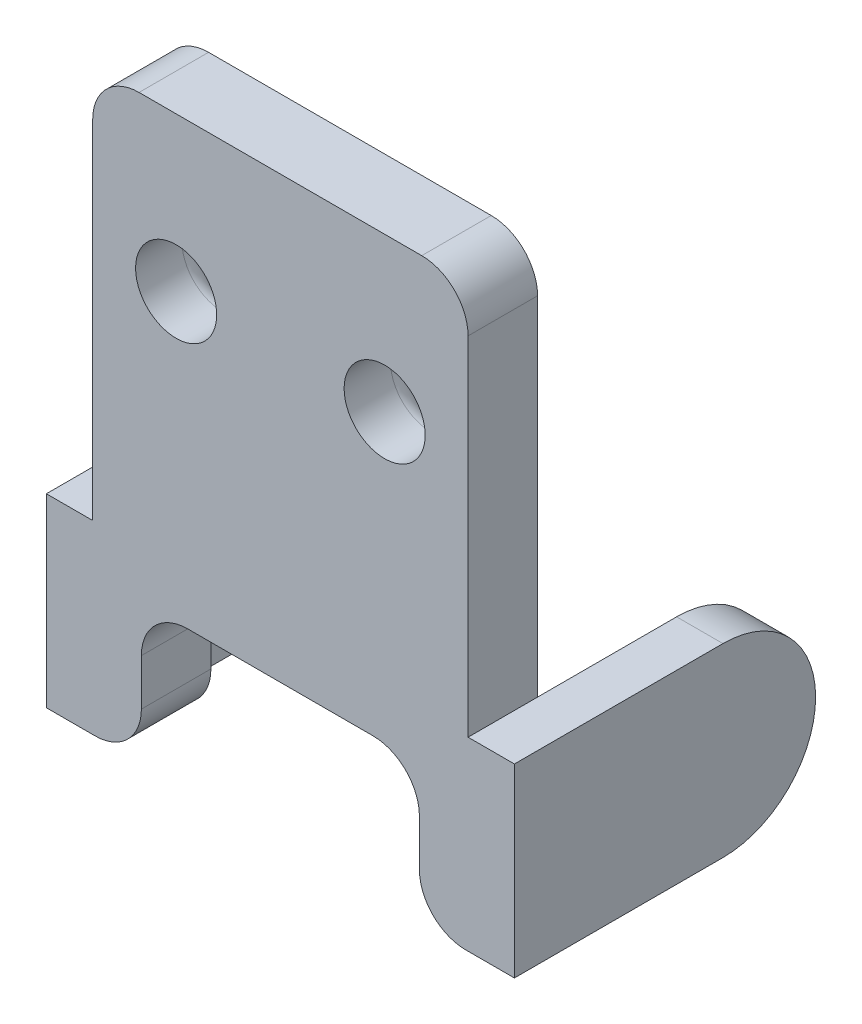
from build123d import *

# Parameters (mm, degrees)
ESQUISSE1_W             = 16.2
ESQUISSE1_H             = 25
BOSS_EXTRU_1_DEPTH      = 3
ESQUISSE2_W             = 13
ESQUISSE2_H             = 8
BOSS_EXTRU_2_DEPTH      = 2
ESQUISSE3_R             = 1.8
BOSS_EXTRU_3_DEPTH      = 1.5
ESQUISSE5_W             = 13
ESQUISSE5_H             = 8
BOSS_EXTRU_4_DEPTH      = 2
ESQUISSE6_R             = 1.8
BOSS_EXTRU_5_DEPTH      = 1.5
ENL_V_MAT_EXTRU_1_REACH = 34.5
ESQUISSE7_W             = 12
ESQUISSE7_H             = 6
ENL_V_MAT_EXTRU_2_REACH = 34.5
ESQUISSE8_R             = 1.75
CONG_1_R                = 1
CONG_2_R                = 4
CONG_3_R                = 2
CONG_4_R                = 2


with BuildPart() as part:
    # Esquisse1 → Boss.-Extru.1 (new body)
    with BuildSketch(Plane.XY):
        with Locations((8.1, 12.5)):
            Rectangle(ESQUISSE1_W, ESQUISSE1_H)
    extrude(amount=BOSS_EXTRU_1_DEPTH)

    # Esquisse2 → Boss.-Extru.2 (add)
    with BuildSketch(Plane.ZY):
        with Locations((-3.5, 4)):
            Rectangle(ESQUISSE2_W, ESQUISSE2_H)
    extrude(amount=BOSS_EXTRU_2_DEPTH)

    # Esquisse3 → Boss.-Extru.3 (add)
    with BuildSketch(Plane(origin=(0, 0, 0), x_dir=(0, 0, -1), z_dir=(1, 0, 0))):
        with Locations(Location((7, 4.035774971, 0), (0, 0, 180))):
            Circle(ESQUISSE3_R)
    extrude(amount=BOSS_EXTRU_3_DEPTH)

    # Esquisse5 → Boss.-Extru.4 (add)
    with BuildSketch(Plane(origin=(16.2, 0, 0), x_dir=(0, 0, -1), z_dir=(1, 0, 0))):
        with Locations((3.5, 4)):
            Rectangle(ESQUISSE5_W, ESQUISSE5_H)
    extrude(amount=BOSS_EXTRU_4_DEPTH)

    # Esquisse6 → Boss.-Extru.5 (add)
    with BuildSketch(Plane.ZY.offset(-16.2)):
        with Locations((-7, 3.879731229)):
            Circle(ESQUISSE6_R)
    extrude(amount=BOSS_EXTRU_5_DEPTH)

    # Esquisse7 → Enlèv. mat.-Extru.1 (cut, up to next)
    with BuildSketch(Plane(origin=(0, 0, 0), x_dir=(-1, 0, 0), z_dir=(0, 0, -1)), mode=Mode.PRIVATE) as enl_v_mat_extru_1_sk1:
        with Locations((-8.1, 3)):
            Rectangle(ESQUISSE7_W, ESQUISSE7_H)
    enl_v_mat_extru_1_tool1 = extrude(enl_v_mat_extru_1_sk1.sketch, amount=-ENL_V_MAT_EXTRU_1_REACH, mode=Mode.PRIVATE) & part.part
    add(enl_v_mat_extru_1_tool1.solids().sort_by_distance((8.1, 3, 0))[0], mode=Mode.SUBTRACT)

    # Esquisse8 → Enlèv. mat.-Extru.2 (cut, up to next)
    with BuildSketch(Plane(origin=(0, 0, 0), x_dir=(-1, 0, 0), z_dir=(0, 0, -1)), mode=Mode.PRIVATE) as enl_v_mat_extru_2_sk1:
        with Locations((-12.6, 18.360124913)):
            Circle(ESQUISSE8_R)
    enl_v_mat_extru_2_tool1 = extrude(enl_v_mat_extru_2_sk1.sketch, amount=-ENL_V_MAT_EXTRU_2_REACH, mode=Mode.PRIVATE) & part.part
    # Esquisse8 → Enlèv. mat.-Extru.2 (cut, up to next)
    with BuildSketch(Plane(origin=(0, 0, 0), x_dir=(-1, 0, 0), z_dir=(0, 0, -1)), mode=Mode.PRIVATE) as enl_v_mat_extru_2_sk2:
        with Locations((-3.6, 18.360124913)):
            Circle(ESQUISSE8_R)
    enl_v_mat_extru_2_tool2 = extrude(enl_v_mat_extru_2_sk2.sketch, amount=-ENL_V_MAT_EXTRU_2_REACH, mode=Mode.PRIVATE) & part.part
    add(enl_v_mat_extru_2_tool1.solids().sort_by_distance((12.6, 18.360125, 0))[0], mode=Mode.SUBTRACT)
    add(enl_v_mat_extru_2_tool2.solids().sort_by_distance((3.6, 18.360125, 0))[0], mode=Mode.SUBTRACT)

    # Congé1
    cong_1_edges = [part.edges().sort_by_distance(p)[0] for p in [
        (14.35, 18.360124913, 0),
        (5.35, 18.360124913, 0),
    ]]
    fillet(cong_1_edges, radius=CONG_1_R)

    # Congé2
    cong_2_edges = [part.edges().sort_by_distance(p)[0] for p in [
        (-1, 8, -10),
        (-1, 0, -10),
        (17.2, 0, -10),
        (17.2, 8, -10),
    ]]
    fillet(cong_2_edges, radius=CONG_2_R - 0.0001)  # a hair under: the kernel refuses the full size

    # Congé3
    cong_3_edges = [part.edges().sort_by_distance(p)[0] for p in [
        (14.1, 0, 1.5),
        (14.1, 6, 1.5),
        (2.1, 6, 1.5),
        (2.1, 0, 1.5),
    ]]
    fillet(cong_3_edges, radius=CONG_3_R)

    # Congé4
    cong_4_edges = [part.edges().sort_by_distance(p)[0] for p in [
        (0, 25, 1.5),
        (16.2, 25, 1.5),
    ]]
    fillet(cong_4_edges, radius=CONG_4_R)


solid = part.part
